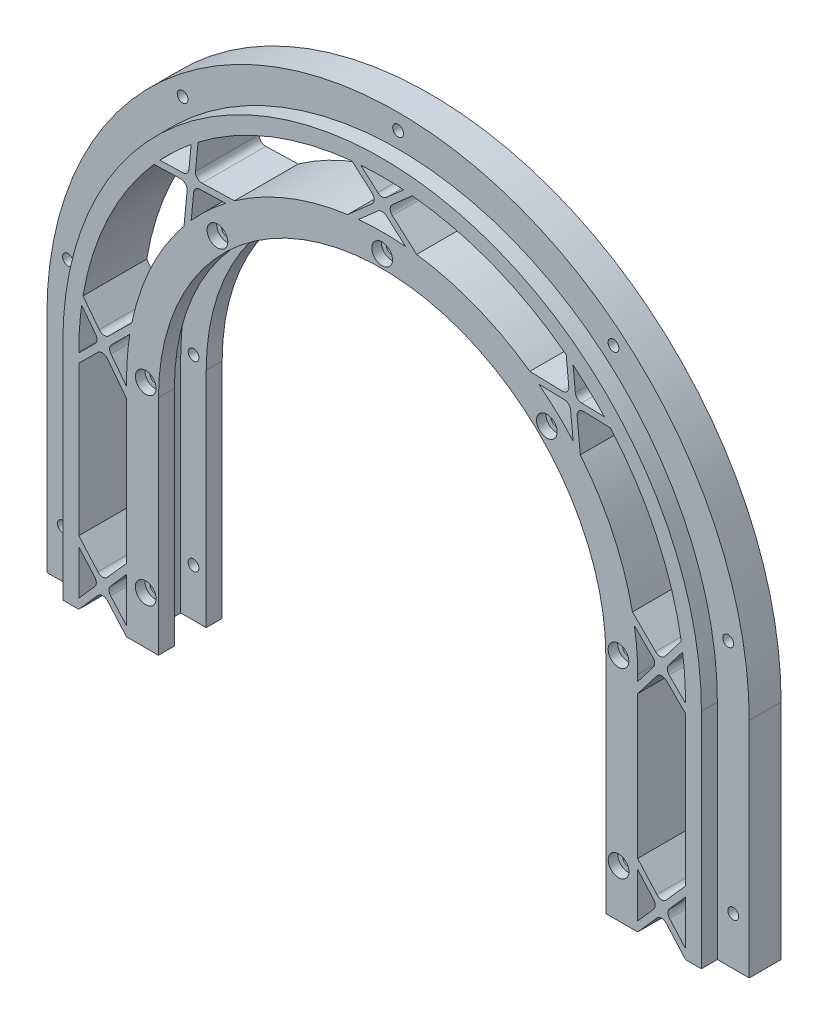
from build123d import *

# Parameters (mm, degrees)
BOSS_EXTRUDE1_DEPTH            = 20
BOSS_EXTRUDE1_2_DEPTH          = 20
BOSS_EXTRUDE2_DEPTH            = 20
CRVPATTERN1_DEPTH              = 20
BOSS_EXTRUDE3_DEPTH            = 20
BOSS_EXTRUDE4_DEPTH            = 5
M3_CLEARANCE_HOLE1_D           = 3.4
CRVPATTERN2_START              = 5
CRVPATTERN2_OUTLINE_R          = 1.7
CRVPATTERN2_DEPTH              = 10
CUT_EXTRUDE1_DEPTH             = 5
CBORE_FOR_M3_SHCS1_D           = 3.4
CBORE_FOR_M3_SHCS1_CBORE_D     = 6.5
CBORE_FOR_M3_SHCS1_CBORE_DEPTH = 3
CRVPATTERN3_START              = 17
CRVPATTERN3_OUTLINE_R          = 3.25
CRVPATTERN3_DEPTH              = 3
CRVPATTERN3_2_OUTLINE_R        = 1.7
CRVPATTERN3_2_DEPTH            = 17


# Read off the part's stored shape, not the designer's step: CrvPattern1, CrvPattern2, CrvPattern3
with BuildPart() as part:
    # Sketch1 → Boss-Extrude1 (new body)
    with BuildSketch(Plane.XY):
        with BuildLine():
            Line((100.2, 0), (100.2, -70))
            Line((100.2, -70), (95.2, -70))
            Line((95.2, -70), (95.2, 0))
            ThreePointArc((95.2, 0), (0, 95.2), (-95.2, 0))
            Line((-95.2, 0), (-95.2, -70))
            Line((-95.2, -70), (-100.2, -70))
            Line((-100.2, -70), (-100.2, 0))
            ThreePointArc((-100.2, 0), (0, 100.2), (100.2, 0))
        make_face()
    extrude(amount=BOSS_EXTRUDE1_DEPTH)



with BuildPart() as body_2:
    # Sketch1 → Boss-Extrude1 2 (new body)
    with BuildSketch(Plane.XY):
        with BuildLine():
            Line((80.2, 0), (80.2, -70))
            Line((80.2, -70), (70.2, -70))
            Line((70.2, -70), (70.2, 0))
            ThreePointArc((70.2, 0), (0, 70.2), (-70.2, 0))
            Line((-70.2, 0), (-70.2, -70))
            Line((-70.2, -70), (-80.2, -70))
            Line((-80.2, -70), (-80.2, 0))
            ThreePointArc((-80.2, 0), (0, 80.2), (80.2, 0))
        make_face()
    extrude(amount=BOSS_EXTRUDE1_2_DEPTH)


with BuildPart() as part_1:
    add(part.part)

    add(body_2.part)  # Boss-Extrude2 merges body 2
    # Sketch1<3> → Boss-Extrude2 (add)
    with BuildSketch(Plane.XY):
        with BuildLine():
            Line((-86.200324289, -63.199632472), (-80.2, -70))
            Line((-80.2, -70), (-80.2, -67))
            Line((-80.2, -67), (-85.208902993, -61.323243274))
            ThreePointArc((-85.208902993, -61.323243274), (-85.709227283, -60), (-85.208902993, -58.676756726))
            Line((-85.208902993, -58.676756726), (-80.2, -53))
            Line((-80.2, -53), (-80.2, -50))
            Line((-80.2, -50), (-86.200324289, -56.800367528))
            ThreePointArc((-86.200324289, -56.800367528), (-87.7, -57.477124254), (-89.199675711, -56.800367528))
            Line((-89.199675711, -56.800367528), (-95.2, -50))
            Line((-95.2, -50), (-95.2, -53))
            Line((-95.2, -53), (-90.191097007, -58.676756726))
            ThreePointArc((-90.191097007, -58.676756726), (-89.690772717, -60), (-90.191097007, -61.323243274))
            Line((-90.191097007, -61.323243274), (-95.2, -67))
            Line((-95.2, -67), (-95.2, -70))
            Line((-95.2, -70), (-89.199675711, -63.199632472))
            ThreePointArc((-89.199675711, -63.199632472), (-87.7, -62.522875746), (-86.200324289, -63.199632472))
        make_face()
    extrude(amount=BOSS_EXTRUDE2_DEPTH)

    # CrvPattern1 outline → CrvPattern1 (add)
    with BuildSketch(Plane.XY):
        with BuildLine():
            Line((80.2, -67), (80.2, -70))
            Line((80.2, -70), (86.200324289, -63.199632472))
            ThreePointArc((86.200324289, -63.199632472), (87.7, -62.522875746), (89.199675711, -63.199632472))
            Line((89.199675711, -63.199632472), (95.2, -70))
            Line((95.2, -70), (95.2, -67))
            Line((95.2, -67), (90.191097007, -61.323243274))
            ThreePointArc((90.191097007, -61.323243274), (89.690772717, -60), (90.191097007, -58.676756726))
            Line((90.191097007, -58.676756726), (95.2, -53))
            Line((95.2, -53), (95.2, -50))
            Line((95.2, -50), (89.199675711, -56.800367528))
            ThreePointArc((89.199675711, -56.800367528), (87.7, -57.477124254), (86.200324289, -56.800367528))
            Line((86.200324289, -56.800367528), (80.2, -50))
            Line((80.2, -50), (80.2, -53))
            Line((80.2, -53), (85.208902993, -58.676756726))
            ThreePointArc((85.208902993, -58.676756726), (85.709227283, -60), (85.208902993, -61.323243274))
            Line((85.208902993, -61.323243274), (80.2, -67))
        make_face()
        with BuildLine():
            Line((-88.780748045, 9.208613975), (-93.874153211, 15.83298326))
            ThreePointArc((-93.874153211, 15.83298326), (-94.09268215, 14.477816337), (-94.291648947, 13.119639434))
            Line((-94.291648947, 13.119639434), (-89.896468902, 7.403366187))
            ThreePointArc((-89.896468902, 7.403366187), (-89.486532971, 6.049390674), (-90.074966986, 4.762906097))
            Line((-90.074966986, 4.762906097), (-95.2, -0.310323138))
            Line((-95.2, -0.310323138), (-95.2, -3.103195368))
            Line((-95.2, -3.103195368), (-89.21236049, 2.823921146))
            ThreePointArc((-89.21236049, 2.823921146), (-87.670454432, 3.397987878), (-86.219839055, 2.621623318))
            Line((-86.219839055, 2.621623318), (-80.691844119, -4.567963741))
            Line((-80.691844119, -4.567963741), (-80.489502546, -1.574795204))
            Line((-80.489502546, -1.574795204), (-85.104118198, 4.426871106))
            ThreePointArc((-85.104118198, 4.426871106), (-85.51405413, 5.780846619), (-84.925620115, 7.067331196))
            Line((-84.925620115, 7.067331196), (-79.545241872, 12.393324633))
            Line((-79.545241872, 12.393324633), (-79.3429003, 15.386493169))
            Line((-79.3429003, 15.386493169), (-85.788226611, 9.006316147))
            ThreePointArc((-85.788226611, 9.006316147), (-87.330132668, 8.432249415), (-88.780748045, 9.208613975))
        make_face()
        with BuildLine():
            Line((-58.571958522, 67.35091291), (-57.769603277, 75.668440827))
            ThreePointArc((-57.769603277, 75.668440827), (-58.854620703, 74.827626061), (-59.927402083, 73.971254414))
            Line((-59.927402083, 73.971254414), (-60.61976714, 66.793927747))
            ThreePointArc((-60.61976714, 66.793927747), (-61.244837279, 65.524839697), (-62.553194644, 64.986789364))
            Line((-62.553194644, 64.986789364), (-69.760875508, 64.780091451))
            ThreePointArc((-69.760875508, 64.780091451), (-70.687653154, 63.767512822), (-71.599734633, 62.741676743))
            Line((-71.599734633, 62.741676743), (-63.247030404, 62.981211007))
            ThreePointArc((-63.247030404, 62.981211007), (-61.728571295, 62.347721593), (-61.198940237, 60.789993169))
            Line((-61.198940237, 60.789993169), (-62.069755651, 51.762780387))
            Line((-62.069755651, 51.762780387), (-59.878063985, 53.811313433))
            Line((-59.878063985, 53.811313433), (-59.151131618, 61.346978331))
            ThreePointArc((-59.151131618, 61.346978331), (-58.52606148, 62.616066381), (-57.217704114, 63.154116715))
            Line((-57.217704114, 63.154116715), (-49.650169543, 63.371134315))
            Line((-49.650169543, 63.371134315), (-47.458477877, 65.419667361))
            Line((-47.458477877, 65.419667361), (-56.523868354, 65.159695072))
            ThreePointArc((-56.523868354, 65.159695072), (-58.042327463, 65.793184485), (-58.571958522, 67.35091291))
        make_face()
        with BuildLine():
            Line((3.199632472, 89.199675711), (9.465381173, 94.728277506))
            ThreePointArc((9.465381173, 94.728277506), (8.098561012, 94.854906618), (6.730057136, 94.96181512))
            Line((6.730057136, 94.96181512), (1.323243274, 90.191097007))
            ThreePointArc((1.323243274, 90.191097007), (0, 89.690772717), (-1.323243274, 90.191097007))
            Line((-1.323243274, 90.191097007), (-6.730057136, 94.96181512))
            ThreePointArc((-6.730057136, 94.96181512), (-8.098561012, 94.854906618), (-9.465381173, 94.728277506))
            Line((-9.465381173, 94.728277506), (-3.199632472, 89.199675711))
            ThreePointArc((-3.199632472, 89.199675711), (-2.522875746, 87.7), (-3.199632472, 86.200324289))
            Line((-3.199632472, 86.200324289), (-10, 80.2))
            Line((-10, 80.2), (-7, 80.2))
            Line((-7, 80.2), (-1.323243274, 85.208902993))
            ThreePointArc((-1.323243274, 85.208902993), (0, 85.709227283), (1.323243274, 85.208902993))
            Line((1.323243274, 85.208902993), (7, 80.2))
            Line((7, 80.2), (10, 80.2))
            Line((10, 80.2), (3.199632472, 86.200324289))
            ThreePointArc((3.199632472, 86.200324289), (2.522875746, 87.7), (3.199632472, 89.199675711))
        make_face()
        with BuildLine():
            Line((63.247030404, 62.981211007), (71.599734633, 62.741676743))
            ThreePointArc((71.599734633, 62.741676743), (70.687653154, 63.767512822), (69.760875508, 64.780091451))
            Line((69.760875508, 64.780091451), (62.553194644, 64.986789364))
            ThreePointArc((62.553194644, 64.986789364), (61.244837279, 65.524839697), (60.61976714, 66.793927747))
            Line((60.61976714, 66.793927747), (59.927402083, 73.971254414))
            ThreePointArc((59.927402083, 73.971254414), (58.854620703, 74.827626061), (57.769603277, 75.668440827))
            Line((57.769603277, 75.668440827), (58.571958522, 67.35091291))
            ThreePointArc((58.571958522, 67.35091291), (58.042327463, 65.793184485), (56.523868354, 65.159695072))
            Line((56.523868354, 65.159695072), (47.458477877, 65.419667361))
            Line((47.458477877, 65.419667361), (49.650169543, 63.371134315))
            Line((49.650169543, 63.371134315), (57.217704114, 63.154116715))
            ThreePointArc((57.217704114, 63.154116715), (58.52606148, 62.616066381), (59.151131618, 61.346978331))
            Line((59.151131618, 61.346978331), (59.878063985, 53.811313433))
            Line((59.878063985, 53.811313433), (62.069755651, 51.762780387))
            Line((62.069755651, 51.762780387), (61.198940237, 60.789993169))
            ThreePointArc((61.198940237, 60.789993169), (61.728571295, 62.347721593), (63.247030404, 62.981211007))
        make_face()
        with BuildLine():
            Line((89.21236049, 2.823921146), (95.2, -3.103195368))
            Line((95.2, -3.103195368), (95.2, -0.310323138))
            Line((95.2, -0.310323138), (90.074966986, 4.762906097))
            ThreePointArc((90.074966986, 4.762906097), (89.486532971, 6.049390674), (89.896468902, 7.403366187))
            Line((89.896468902, 7.403366187), (94.291648947, 13.119639434))
            ThreePointArc((94.291648947, 13.119639434), (94.09268215, 14.477816337), (93.874153211, 15.83298326))
            Line((93.874153211, 15.83298326), (88.780748045, 9.208613975))
            ThreePointArc((88.780748045, 9.208613975), (87.330132668, 8.432249415), (85.788226611, 9.006316147))
            Line((85.788226611, 9.006316147), (79.3429003, 15.386493169))
            Line((79.3429003, 15.386493169), (79.545241872, 12.393324633))
            Line((79.545241872, 12.393324633), (84.925620115, 7.067331196))
            ThreePointArc((84.925620115, 7.067331196), (85.51405413, 5.780846619), (85.104118198, 4.426871106))
            Line((85.104118198, 4.426871106), (80.489502546, -1.574795204))
            Line((80.489502546, -1.574795204), (80.691844119, -4.567963741))
            Line((80.691844119, -4.567963741), (86.219839055, 2.621623318))
            ThreePointArc((86.219839055, 2.621623318), (87.670454432, 3.397987878), (89.21236049, 2.823921146))
        make_face()
    extrude(amount=CRVPATTERN1_DEPTH)

    # Sketch3 → Boss-Extrude3 (add)
    with BuildSketch(Plane.XY.offset(20)):
        Polygon((-10, 80.2), (-10.833000961, 79.464999152), (-7.386306315, 79.859141487), (-7, 80.2), align=None)
        Polygon((10, 80.2), (7, 80.2), (7.386306315, 79.859141487), (10.833000961, 79.464999152), align=None)
        Polygon((-62.069755651, 51.762780387), (-62.176424897, 50.65700531), (-59.927532119, 53.298507428), (-59.878063985, 53.811313433), align=None)
        Polygon((-47.458477877, 65.419667361), (-49.650169543, 63.371134315), (-49.13519479, 63.385902478), (-46.34802628, 65.451512282), align=None)
        Polygon((49.650169543, 63.371134315), (47.458477877, 65.419667361), (46.34802628, 65.451512282), (49.13519479, 63.385902478), align=None)
        Polygon((59.878063985, 53.811313433), (62.069755651, 51.762780387), (62.176424897, 50.65700531), (59.927532119, 53.298507428), align=None)
        Polygon((80.691844119, -4.567963741), (80.489502546, -1.574795204), (80.2, -1.951315765), (80.2, -5.207645244), align=None)
        Polygon((79.545241872, 12.393324633), (79.179104271, 12.755761319), (78.553389587, 16.168023517), (79.3429003, 15.386493169), align=None)
        Polygon((-80.489502546, -1.574795204), (-80.691844119, -4.567963741), (-80.2, -5.207645244), (-80.2, -1.951315765), align=None)
        Polygon((-79.3429003, 15.386493169), (-78.553389587, 16.168023517), (-79.179104271, 12.755761319), (-79.545241872, 12.393324633), align=None)
    extrude(amount=-BOSS_EXTRUDE3_DEPTH)

    # Sketch4 → Boss-Extrude4 (add, symmetric)
    with BuildSketch(Plane.XY.offset(10)):
        with BuildLine():
            Line((-110.2, -70), (-110.2, 0))
            ThreePointArc((-110.2, 0), (0, 110.2), (110.2, 0))
            Line((110.2, 0), (110.2, -70))
            Line((110.2, -70), (100.2, -70))
            Line((100.2, -70), (100.2, 0))
            ThreePointArc((100.2, 0), (0, 100.2), (-100.2, 0))
            Line((-100.2, 0), (-100.2, -70))
            Line((-100.2, -70), (-110.2, -70))
        make_face()
    extrude(amount=BOSS_EXTRUDE4_DEPTH, both=True)

    # M3 Clearance Hole1 (through all)
    with Locations(Plane(origin=(-105.2, -55, 15), x_dir=(1, 0, 0), z_dir=(0, 0, 1))):
        with Locations((0, 0)):
            Hole(M3_CLEARANCE_HOLE1_D / 2)

    # CrvPattern2 outline → CrvPattern2 (cut)
    with BuildSketch(Plane.XY.offset(CRVPATTERN2_START)):
        with Locations((-103.59220022, 18.322010084)):
            Circle(CRVPATTERN2_OUTLINE_R)
        with Locations((-67.600164716, 80.605568855)):
            Circle(CRVPATTERN2_OUTLINE_R)
        with Locations((0, 105.2)):
            Circle(CRVPATTERN2_OUTLINE_R)
        with Locations((67.600164716, 80.605568855)):
            Circle(CRVPATTERN2_OUTLINE_R)
        with Locations((103.59220022, 18.322010084)):
            Circle(CRVPATTERN2_OUTLINE_R)
        with Locations((105.2, -55)):
            Circle(CRVPATTERN2_OUTLINE_R)
    extrude(amount=CRVPATTERN2_DEPTH, mode=Mode.SUBTRACT)

    # Sketch7 → Cut-Extrude1 (cut, symmetric)
    with BuildSketch(Plane.XY.offset(10)):
        with BuildLine():
            Line((-78.2, -70), (-70.2, -70))
            Line((-70.2, -70), (-70.2, 0))
            ThreePointArc((-70.2, 0), (0, 70.2), (70.2, 0))
            Line((70.2, 0), (70.2, -70))
            Line((70.2, -70), (78.2, -70))
            Line((78.2, -70), (78.2, 0))
            ThreePointArc((78.2, 0), (0, 78.2), (-78.2, 0))
            Line((-78.2, 0), (-78.2, -70))
        make_face()
    extrude(amount=CUT_EXTRUDE1_DEPTH, both=True, mode=Mode.SUBTRACT)

    # CBORE for M3 SHCS1 (through all)
    with Locations(Plane(origin=(-74.2, -55, 20), x_dir=(1, 0, 0), z_dir=(0, 0, 1))):
        with Locations((0, 0)):
            CounterBoreHole(CBORE_FOR_M3_SHCS1_D / 2, CBORE_FOR_M3_SHCS1_CBORE_D / 2, CBORE_FOR_M3_SHCS1_CBORE_DEPTH)

    # CrvPattern3 outline → CrvPattern3 (cut)
    with BuildSketch(Plane.XY.offset(CRVPATTERN3_START)):
        with Locations((-74.167849765, 2.184046985)):
            Circle(CRVPATTERN3_OUTLINE_R)
        with Locations((-51.689378569, 53.233900319)):
            Circle(CRVPATTERN3_OUTLINE_R)
        with Locations((0, 74.2)):
            Circle(CRVPATTERN3_OUTLINE_R)
        with Locations((51.689378569, 53.233900319)):
            Circle(CRVPATTERN3_OUTLINE_R)
        with Locations((74.167849765, 2.184046985)):
            Circle(CRVPATTERN3_OUTLINE_R)
        with Locations((74.2, -55)):
            Circle(CRVPATTERN3_OUTLINE_R)
    extrude(amount=CRVPATTERN3_DEPTH, mode=Mode.SUBTRACT)

    # CrvPattern3 2 outline → CrvPattern3 2 (cut)
    with BuildSketch(Plane.XY):
        with Locations((-74.167849765, 2.184046985)):
            Circle(CRVPATTERN3_2_OUTLINE_R)
        with Locations((-51.689378569, 53.233900319)):
            Circle(CRVPATTERN3_2_OUTLINE_R)
        with Locations((0, 74.2)):
            Circle(CRVPATTERN3_2_OUTLINE_R)
        with Locations((51.689378569, 53.233900319)):
            Circle(CRVPATTERN3_2_OUTLINE_R)
        with Locations((74.167849765, 2.184046985)):
            Circle(CRVPATTERN3_2_OUTLINE_R)
        with Locations((74.2, -55)):
            Circle(CRVPATTERN3_2_OUTLINE_R)
    extrude(amount=CRVPATTERN3_2_DEPTH, mode=Mode.SUBTRACT)


solid = part_1.part
